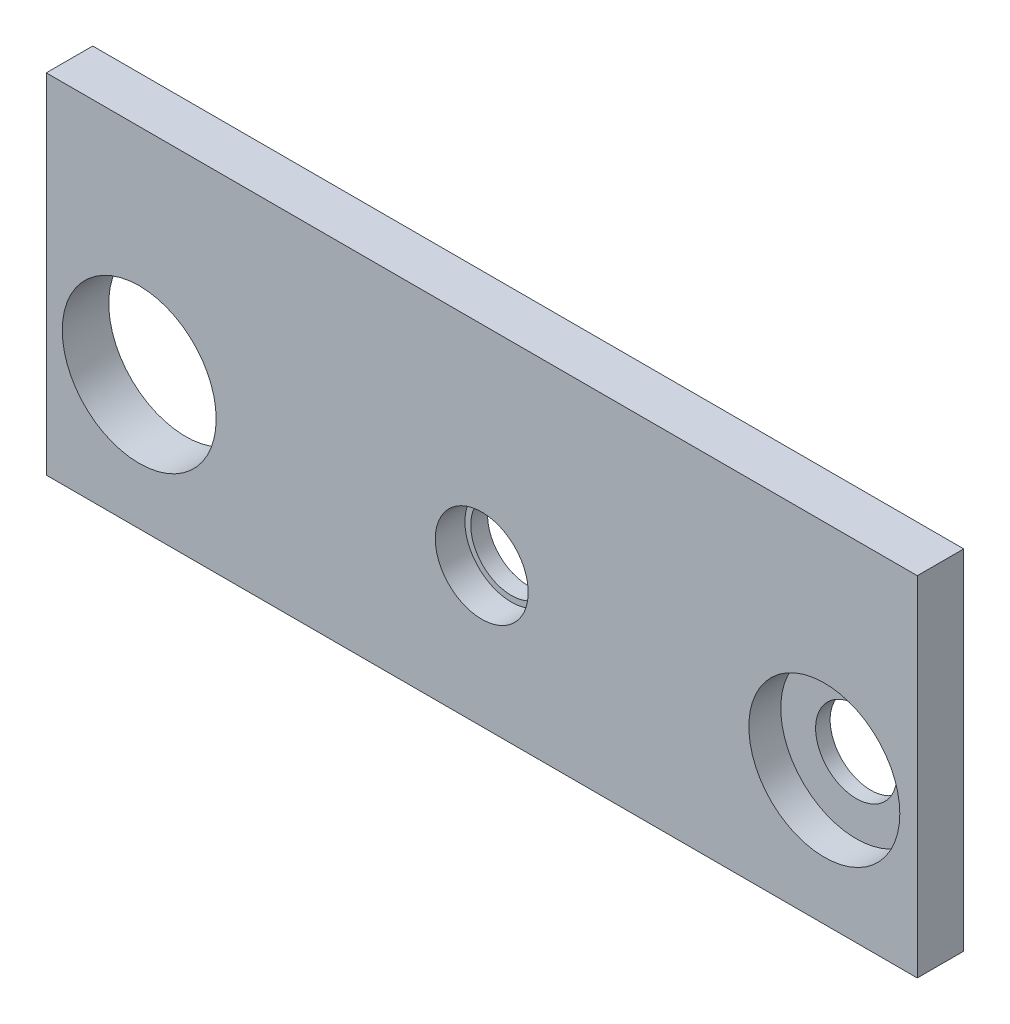
from build123d import *

# Parameters (mm, degrees)
ESQUISSE1_W                  = 150
ESQUISSE1_H                  = 60
BOSS_EXTRU_1_DEPTH           = 8
ENL_V_MAT_EXTRU_1_DEPTH      = 162.752897965
ENL_V_MAT_EXTRU_1_DEPTH_BACK = 5.1
ESQUISSE2_R                  = 8
ESQUISSE3_R                  = 7
ENL_V_MAT_EXTRU_2_DEPTH      = 162.635423098
ESQUISSE4_R                  = 7
ENL_V_MAT_EXTRU_3_DEPTH      = 162.752897965
ESQUISSE5_R                  = 13
ENL_V_MAT_EXTRU_4_DEPTH      = 5.5
ENL_V_MAT_EXTRU_5_DEPTH      = 162.752897965
ENL_V_MAT_EXTRU_5_DEPTH_BACK = 162.752897965
ESQUISSE6_R                  = 13.25


with BuildPart() as part:
    # Esquisse1 → Boss.-Extru.1 (new body)
    with BuildSketch(Plane.XY):
        with Locations((75, 30)):
            Rectangle(ESQUISSE1_W, ESQUISSE1_H)
    extrude(amount=BOSS_EXTRU_1_DEPTH)

    # Esquisse2 → Enlèv. mat.-Extru.1 (cut, two sides: drawn at the far end of the back side and taken through both)
    with BuildSketch(Plane.XY.offset(8).offset(-ENL_V_MAT_EXTRU_1_DEPTH_BACK)):
        with Locations((75, 24)):
            Circle(ESQUISSE2_R)
    extrude(amount=ENL_V_MAT_EXTRU_1_DEPTH + ENL_V_MAT_EXTRU_1_DEPTH_BACK, mode=Mode.SUBTRACT)

    # Esquisse3 → Enlèv. mat.-Extru.2 (cut, through all)
    with BuildSketch(Plane.XY.offset(2.9)):
        with Locations((75, 24)):
            Circle(ESQUISSE3_R)
    extrude(amount=-ENL_V_MAT_EXTRU_2_DEPTH, mode=Mode.SUBTRACT)

    # Esquisse4 → Enlèv. mat.-Extru.3 (cut, through all)
    with BuildSketch(Plane.XY.offset(8)):
        with Locations((133.991524815, 23)):
            Circle(ESQUISSE4_R)
    extrude(amount=-ENL_V_MAT_EXTRU_3_DEPTH, mode=Mode.SUBTRACT)

    # Esquisse5 → Enlèv. mat.-Extru.4 (cut)
    with BuildSketch(Plane.XY.offset(8)):
        with Locations((133.991524815, 23)):
            Circle(ESQUISSE5_R)
    extrude(amount=-ENL_V_MAT_EXTRU_4_DEPTH, mode=Mode.SUBTRACT)

    # Esquisse6 → Enlèv. mat.-Extru.5 (cut, two sides: drawn at the far end of the back side and taken through both)
    with BuildSketch(Plane.XY.offset(8).offset(-ENL_V_MAT_EXTRU_5_DEPTH_BACK)):
        with Locations((16.008475185, 23)):
            Circle(ESQUISSE6_R)
    extrude(amount=ENL_V_MAT_EXTRU_5_DEPTH + ENL_V_MAT_EXTRU_5_DEPTH_BACK, mode=Mode.SUBTRACT)


solid = part.part
